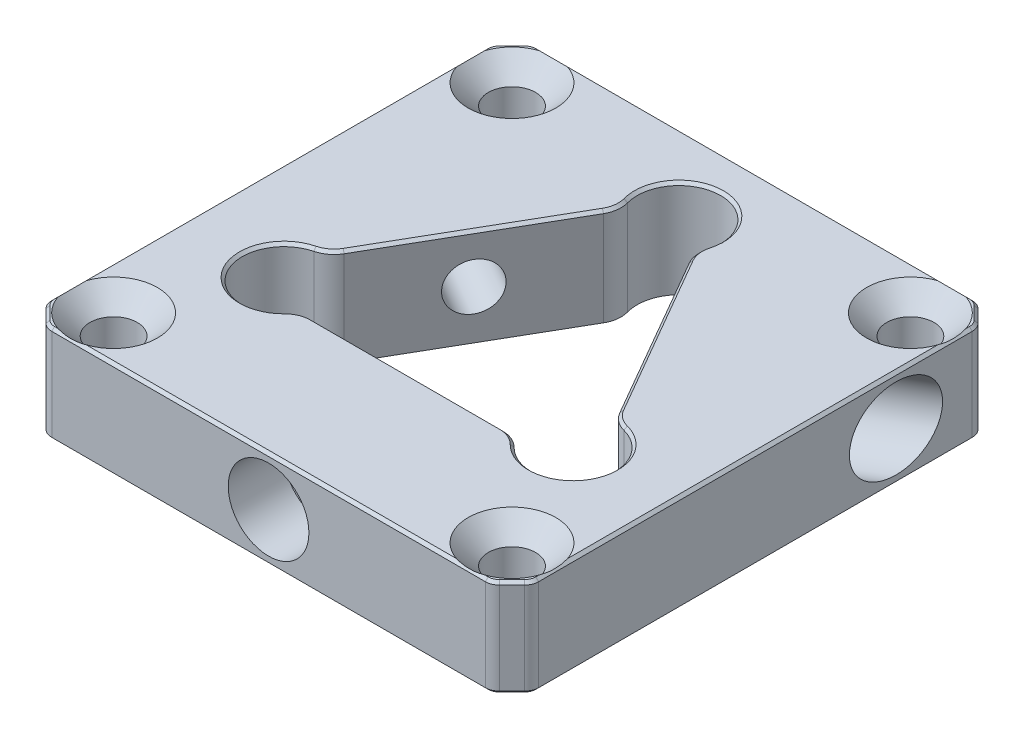
from build123d import *

# Parameters (mm, degrees)
SKETCH_36_W                  = 35
SKETCH_36_H                  = 35
EXTRUDE_8_DEPTH              = 7
SKETCH_37_R                  = 1
CUT_EXTRUDE_8_DEPTH          = 14
HOLE_WIZARD_M3_2_D           = 3.4
HOLE_WIZARD_M3_2_CSINK_D     = 6.3
HOLE_WIZARD_M3_2_CSINK_ANGLE = 90
CUT_EXTRUDE_9_DEPTH          = 9
FILLET_8_R                   = 3
SKETCH_41_R                  = 3
CUT_EXTRUDE_10_DEPTH         = 25.5
CHAMFER_3_SIZE               = 1.5
FILLET_9_R                   = 1
SKETCH_44_R                  = 1.7
CUT_EXTRUDE_11_DEPTH         = 16
PATTERN_CIRCULAR_4_COUNT     = 3
SKETCH_46_R                  = 2.9
CUT_EXTRUDE_12_DEPTH         = 9
SKETCH_47_R                  = 2.9
CUT_EXTRUDE_13_DEPTH         = 9
SKETCH_48_R                  = 2.9
CUT_EXTRUDE_14_DEPTH         = 4
FILLET_10_R                  = 2
SKETCH_49_R                  = 1
CUT_EXTRUDE_15_DEPTH         = 6
HOLE_WIZARD_M3_1_D           = 2.5
HOLE_WIZARD_M3_1_DEPTH       = 7
HOLE_WIZARD_M3_1_TIP         = 0.751075774
CHAMFER_4_SIZE               = 0.2
CHAMFER_5_SIZE               = 0.2


with BuildPart() as part:
    # 草图36 → 凸台-拉伸8 (new body)
    with BuildSketch(Plane(origin=(0, 0, 0), x_dir=(1, 0, 0), z_dir=(0, 1, 0))):
        Rectangle(SKETCH_36_W, SKETCH_36_H)
    extrude(amount=EXTRUDE_8_DEPTH)

    # 草图37 → 切除-拉伸8 (cut)
    with BuildSketch(Plane(origin=(0, 7, 0), x_dir=(1, 0, 0), z_dir=(0, 1, 0))):
        with Locations(Location((-14.32, 14.32, 0), (0, 0, 270))):
            Circle(SKETCH_37_R)
        with Locations(Location((14.32, 14.32, 0), (0, 0, 270))):
            Circle(SKETCH_37_R)
        with Locations(Location((14.32, -14.32, 0), (0, 0, 270))):
            Circle(SKETCH_37_R)
        with Locations(Location((-14.32, -14.32, 0), (0, 0, 270))):
            Circle(SKETCH_37_R)
    extrude(amount=-CUT_EXTRUDE_8_DEPTH, mode=Mode.SUBTRACT)

    # M3 十字槽半沉头木螺钉的锥形沉头孔2 (through all)
    with Locations(Plane(origin=(0, 7, 0), x_dir=(1, 0, 0), z_dir=(0, 1, 0))):
        with Locations((-14.32, 14.32), (-14.32, -14.32), (14.32, -14.32), (14.32, 14.32)):
            CounterSinkHole(HOLE_WIZARD_M3_2_D / 2, HOLE_WIZARD_M3_2_CSINK_D / 2, counter_sink_angle=HOLE_WIZARD_M3_2_CSINK_ANGLE)

    # 草图40 → 切除-拉伸9 (cut)
    with BuildSketch(Plane(origin=(0, 7, 0), x_dir=(1, 0, 0), z_dir=(0, 1, 0))):
        Polygon((0, 15), (-12.990381057, -7.5), (12.990381057, -7.5), align=None)
    extrude(amount=-CUT_EXTRUDE_9_DEPTH, mode=Mode.SUBTRACT)

    # 圆角8
    fillet_8_edges = [part.edges().sort_by_distance(p)[0] for p in [
        (0, 3.5, -15),
        (12.990381057, 3.5, 7.5),
        (-12.990381057, 3.5, 7.5),
    ]]
    fillet(fillet_8_edges, radius=FILLET_8_R)

    # 草图41 → 切除-拉伸10 (cut)
    with BuildSketch(Plane(origin=(0, 7, 0), x_dir=(1, 0, 0), z_dir=(0, 1, 0))):
        with Locations((0, 12)):
            Circle(SKETCH_41_R)
        with Locations((10.392304845, -6)):
            Circle(SKETCH_41_R)
        with Locations((-10.392304845, -6)):
            Circle(SKETCH_41_R)
    extrude(amount=-CUT_EXTRUDE_10_DEPTH, mode=Mode.SUBTRACT)

    # 倒角3
    chamfer_3_edges = [part.edges().sort_by_distance(p)[0] for p in [
        (17.5, 3.5, 17.5),
        (-17.5, 3.5, 17.5),
        (-17.5, 3.5, -17.5),
        (17.5, 3.5, -17.5),
    ]]
    chamfer(chamfer_3_edges, length=CHAMFER_3_SIZE)

    # 圆角9
    fillet_9_edges = [part.edges().sort_by_distance(p)[0] for p in [
        (16, 3.5, 17.5),
        (-16, 3.5, 17.5),
        (-17.5, 3.5, -16),
        (-17.5, 3.5, 16),
        (17.5, 3.5, -16),
        (17.5, 3.5, 16),
        (16, 3.5, -17.5),
        (-16, 3.5, -17.5),
    ]]
    fillet(fillet_9_edges, radius=FILLET_9_R)

    # 草图44 → 切除-拉伸11 (cut)
    with BuildSketch(Plane(origin=(-6.495190528, 0, -3.75), x_dir=(0.5000000000000003, 0, -0.8660254037844386), z_dir=(0.8660254037844386, 0, 0.5000000000000003))):
        with Locations((0, 3.5)):
            Circle(SKETCH_44_R)
    cut_extrude_11 = extrude(amount=-CUT_EXTRUDE_11_DEPTH, mode=Mode.SUBTRACT)

    # 阵列(圆周)4: 切除-拉伸11 ×3 about axis
    pattern_circular_4_axis = Axis((0, 61.25, 0), (0, -1, 0))
    for i in range(1, PATTERN_CIRCULAR_4_COUNT):
        add(cut_extrude_11.rotate(pattern_circular_4_axis, i * 360 / PATTERN_CIRCULAR_4_COUNT), mode=Mode.SUBTRACT)

    # 草图46 → 切除-拉伸12 (cut)
    with BuildSketch(Plane(origin=(-19.485571585, 0, -11.25), x_dir=(0.5000000000000003, 0, -0.8660254037844386), z_dir=(0.8660254037844386, 0, 0.5000000000000003))):
        with Locations(Location((0, 3.5, 0), (0, 0, 180))):
            Circle(SKETCH_46_R)
    extrude(amount=CUT_EXTRUDE_12_DEPTH, mode=Mode.SUBTRACT)

    # 草图47 → 切除-拉伸13 (cut)
    with BuildSketch(Plane(origin=(19.485571585, 0, -11.25), x_dir=(0.5000000000000003, 0, 0.8660254037844386), z_dir=(-0.8660254037844386, 0, 0.5000000000000003))):
        with Locations(Location((0, 3.5, 0), (0, 0, 180))):
            Circle(SKETCH_47_R)
    extrude(amount=CUT_EXTRUDE_13_DEPTH, mode=Mode.SUBTRACT)

    # 草图48 → 切除-拉伸14 (cut)
    with BuildSketch(Plane.XY.offset(17.5)):
        with Locations((0, 3.5)):
            Circle(SKETCH_48_R)
    extrude(amount=-CUT_EXTRUDE_14_DEPTH, mode=Mode.SUBTRACT)

    # 圆角10
    fillet_10_edges = [part.edges().sort_by_distance(p)[0] for p in [
        (2.598076211, 3.5, -10.5),
        (10.392304845, 3.5, 3),
        (-7.794228634, 3.5, 7.5),
        (7.794228634, 3.5, 7.5),
        (-2.598076211, 3.5, -10.5),
        (-10.392304845, 3.5, 3),
    ]]
    fillet(fillet_10_edges, radius=FILLET_10_R)

    # 草图49 → 切除-拉伸15 (cut)
    with BuildSketch(Plane(origin=(0, 0, -17.5), x_dir=(-1, 0, 0), z_dir=(0, 0, -1))):
        with Locations((-8, 3.5)):
            Circle(SKETCH_49_R)
        with Locations(Location((8, 3.5, 0), (0, 0, 180))):
            Circle(SKETCH_49_R)
    extrude(amount=-CUT_EXTRUDE_15_DEPTH, mode=Mode.SUBTRACT)

    # M3 螺纹孔1
    with Locations(Plane(origin=(0, 0, -17.5), x_dir=(-1, 0, 0), z_dir=(0, 0, -1))):
        with Locations((-8, 3.5), (8, 3.5)):
            Hole(HOLE_WIZARD_M3_1_D / 2, depth=HOLE_WIZARD_M3_1_DEPTH)
            with Locations((0, 0, -(HOLE_WIZARD_M3_1_DEPTH + HOLE_WIZARD_M3_1_TIP / 2))):  # 118° drill point
                Cone(0, HOLE_WIZARD_M3_1_D / 2, HOLE_WIZARD_M3_1_TIP, mode=Mode.SUBTRACT)

    # 倒角4
    # the kernel refuses this chamfer: 0.2 mm, written as the material it takes off along each edge
    with BuildSketch(Plane(origin=(-17.5, 0, 15.585786438), x_dir=(0.9996219169112968, -0.02749587661058673, 0), z_dir=(0, 0, -1)), Plane(origin=(-17.5, 7, 15.585786438), x_dir=(-0.027495876610578673, -0.999621916911297, 0), z_dir=(0, 0, -1)), Plane(origin=(15.585786438, 7, 17.5), x_dir=(0, -0.999621916911297, 0.027495876610578673), z_dir=(-1, 0, 0)), Plane(origin=(17.5, 7, -15.585786438), x_dir=(0.027495876610578673, -0.999621916911297, 0), z_dir=(0, 0, 1)), Plane(origin=(-15.585786438, 7, -17.5), x_dir=(0, -0.999621916911297, -0.027495876610578673), z_dir=(1, 0, 0)), Plane(origin=(15.585786438, 0, 17.5), x_dir=(0, -0.027495876610586726, -0.9996219169112966), z_dir=(-1, 0, 0)), Plane(origin=(-15.585786438, 0, -17.5), x_dir=(0, -0.027495876610586726, 0.9996219169112966), z_dir=(1, 0, 0)), Plane(origin=(17.5, 0, -15.585786438), x_dir=(-0.9996219169112968, -0.02749587661058673, 0), z_dir=(0, 0, 1))) as chamfer_4_piece_1:
        Polygon((CHAMFER_4_SIZE * 0.999621916911, -CHAMFER_4_SIZE * 0.0274958766106), (-CHAMFER_4_SIZE * 0.0274958766106, -CHAMFER_4_SIZE * 0.999621916911), (0, 0), align=None)
    extrude(amount=31.171572875, mode=Mode.SUBTRACT)
    with BuildSketch(Plane(origin=(-17.207106781, 7, 16.292893219), x_dir=(-0.019442520806012033, -0.9996219169112968, 0.019442520806012033), z_dir=(0.7071067811865476, 0, 0.7071067811865476)), Plane(origin=(16.292893219, 7, 17.207106781), x_dir=(0.019442520806020658, -0.9996219169112964, 0.019442520806020658), z_dir=(0.7071067811865476, 0, -0.7071067811865476)), Plane(origin=(17.207106781, 7, -16.292893219), x_dir=(0.019442520806020658, -0.9996219169112964, -0.019442520806020658), z_dir=(-0.7071067811865476, 0, -0.7071067811865476)), Plane(origin=(-17.207106781, 0, 16.292893219), x_dir=(0.7068394360706735, -0.027495876610586372, -0.7068394360706735), z_dir=(0.7071067811865476, 0, 0.7071067811865476)), Plane(origin=(17.207106781, 0, -16.292893219), x_dir=(-0.7068394360706735, -0.0274958766105862, 0.7068394360706735), z_dir=(-0.7071067811865476, 0, -0.7071067811865476)), Plane(origin=(16.292893219, 0, 17.207106781), x_dir=(-0.7068394360706735, -0.0274958766105862, -0.7068394360706735), z_dir=(0.7071067811865476, 0, -0.7071067811865476))) as chamfer_4_piece_2:
        Polygon((CHAMFER_4_SIZE * 0.999621916911, CHAMFER_4_SIZE * 0.0274958766106), (-CHAMFER_4_SIZE * 0.0274958766106, CHAMFER_4_SIZE * 0.999621916911), (0, 0), align=None)
    extrude(amount=1.292893219, mode=Mode.SUBTRACT)
    with BuildSketch(Plane(origin=(-17.207106781, 7, -16.292893219), x_dir=(-0.019442520806012033, -0.9996219169112968, -0.019442520806012033), z_dir=(0.7071067811865476, 0, -0.7071067811865476)), Plane(origin=(-17.207106781, 0, -16.292893219), x_dir=(0.7068394360706735, -0.027495876610586372, 0.7068394360706735), z_dir=(0.7071067811865476, 0, -0.7071067811865476))) as chamfer_4_piece_3:
        Polygon((CHAMFER_4_SIZE * 0.999621916911, -CHAMFER_4_SIZE * 0.0274958766106), (-CHAMFER_4_SIZE * 0.0274958766106, -CHAMFER_4_SIZE * 0.999621916911), (0, 0), align=None)
    extrude(amount=1.292893219, mode=Mode.SUBTRACT)
    with BuildSketch(Plane(origin=(-15.585786438, 7, -16.5), x_dir=(0, 0, -1), z_dir=(1, 0, 0))) as chamfer_4_piece_4:
        Polygon((1, -CHAMFER_4_SIZE), (1 - CHAMFER_4_SIZE, 0), (1, 0), align=None)
    revolve(axis=Axis((-15.585786438, 7, -16.5), (0, 1, 0)), revolution_arc=45, mode=Mode.SUBTRACT)
    with BuildSketch(Plane(origin=(-16.5, 7, -15.585786438), x_dir=(-0.7071067811865476, 0, -0.7071067811865476), z_dir=(0.7071067811865476, 0, -0.7071067811865476))) as chamfer_4_piece_5:
        Polygon((1, -CHAMFER_4_SIZE), (1 - CHAMFER_4_SIZE, 0), (1, 0), align=None)
    revolve(axis=Axis((-16.5, 7, -15.585786438), (0, 1, 0)), revolution_arc=45, mode=Mode.SUBTRACT)
    with BuildSketch(Plane(origin=(15.585786438, 7, -16.5), x_dir=(0, 0, -1), z_dir=(-1, 0, 0))) as chamfer_4_piece_6:
        Polygon((1, CHAMFER_4_SIZE), (1 - CHAMFER_4_SIZE, 0), (1, 0), align=None)
    revolve(axis=Axis((15.585786438, 7, -16.5), (0, -1, 0)), revolution_arc=45, mode=Mode.SUBTRACT)
    with BuildSketch(Plane(origin=(16.5, 7, -15.585786438), x_dir=(0.7071067811865458, 0, -0.7071067811865493), z_dir=(-0.7071067811865493, 0, -0.7071067811865458))) as chamfer_4_piece_7:
        Polygon((1, CHAMFER_4_SIZE), (1 - CHAMFER_4_SIZE, 0), (1, 0), align=None)
    revolve(axis=Axis((16.5, 7, -15.585786438), (0, -1, 0)), revolution_arc=45, mode=Mode.SUBTRACT)
    with BuildSketch(Plane(origin=(16.5, 7, 15.585786438), x_dir=(1, 0, 0), z_dir=(0, 0, -1))) as chamfer_4_piece_8:
        Polygon((1, CHAMFER_4_SIZE), (1 - CHAMFER_4_SIZE, 0), (1, 0), align=None)
    revolve(axis=Axis((16.5, 7, 15.585786438), (0, -1, 0)), revolution_arc=45, mode=Mode.SUBTRACT)
    with BuildSketch(Plane(origin=(15.585786438, 7, 16.5), x_dir=(0.7071067811865476, 0, 0.7071067811865476), z_dir=(0.7071067811865476, 0, -0.7071067811865476))) as chamfer_4_piece_9:
        Polygon((1, CHAMFER_4_SIZE), (1 - CHAMFER_4_SIZE, 0), (1, 0), align=None)
    revolve(axis=Axis((15.585786438, 7, 16.5), (0, -1, 0)), revolution_arc=45, mode=Mode.SUBTRACT)
    with BuildSketch(Plane(origin=(-15.585786438, 7, 16.5), x_dir=(-0.7071067811865476, 0, 0.7071067811865476), z_dir=(-0.7071067811865476, 0, -0.7071067811865476))) as chamfer_4_piece_10:
        Polygon((1, -CHAMFER_4_SIZE), (1 - CHAMFER_4_SIZE, 0), (1, 0), align=None)
    revolve(axis=Axis((-15.585786438, 7, 16.5), (0, 1, 0)), revolution_arc=45, mode=Mode.SUBTRACT)
    with BuildSketch(Plane(origin=(-16.5, 7, 15.585786438), x_dir=(-1, 0, 0), z_dir=(0, 0, -1))) as chamfer_4_piece_11:
        Polygon((1, -CHAMFER_4_SIZE), (1 - CHAMFER_4_SIZE, 0), (1, 0), align=None)
    revolve(axis=Axis((-16.5, 7, 15.585786438), (0, 1, 0)), revolution_arc=45, mode=Mode.SUBTRACT)
    with BuildSketch(Plane(origin=(-15.585786438, 0, -16.5), x_dir=(0, 0, -1), z_dir=(1, 0, 0))) as chamfer_4_piece_12:
        Polygon((1 - CHAMFER_4_SIZE, 0), (1, CHAMFER_4_SIZE), (1, 0), align=None)
    revolve(axis=Axis((-15.585786438, 0, -16.5), (0, 1, 0)), revolution_arc=45, mode=Mode.SUBTRACT)
    with BuildSketch(Plane(origin=(-16.5, 0, -15.585786438), x_dir=(-0.7071067811865476, 0, -0.7071067811865476), z_dir=(0.7071067811865476, 0, -0.7071067811865476))) as chamfer_4_piece_13:
        Polygon((1 - CHAMFER_4_SIZE, 0), (1, CHAMFER_4_SIZE), (1, 0), align=None)
    revolve(axis=Axis((-16.5, 0, -15.585786438), (0, 1, 0)), revolution_arc=45, mode=Mode.SUBTRACT)
    with BuildSketch(Plane(origin=(15.585786438, 0, -16.5), x_dir=(0, 0, -1), z_dir=(-1, 0, 0))) as chamfer_4_piece_14:
        Polygon((1 - CHAMFER_4_SIZE, 0), (1, -CHAMFER_4_SIZE), (1, 0), align=None)
    revolve(axis=Axis((15.585786438, 0, -16.5), (0, -1, 0)), revolution_arc=45, mode=Mode.SUBTRACT)
    with BuildSketch(Plane(origin=(16.5, 0, -15.585786438), x_dir=(0.7071067811865476, 0, -0.7071067811865476), z_dir=(-0.7071067811865476, 0, -0.7071067811865476))) as chamfer_4_piece_15:
        Polygon((1 - CHAMFER_4_SIZE, 0), (1, -CHAMFER_4_SIZE), (1, 0), align=None)
    revolve(axis=Axis((16.5, 0, -15.585786438), (0, -1, 0)), revolution_arc=45, mode=Mode.SUBTRACT)
    with BuildSketch(Plane(origin=(16.5, 0, 15.585786438), x_dir=(1, 0, 0), z_dir=(0, 0, -1))) as chamfer_4_piece_16:
        Polygon((1 - CHAMFER_4_SIZE, 0), (1, -CHAMFER_4_SIZE), (1, 0), align=None)
    revolve(axis=Axis((16.5, 0, 15.585786438), (0, -1, 0)), revolution_arc=45, mode=Mode.SUBTRACT)
    with BuildSketch(Plane(origin=(15.585786438, 0, 16.5), x_dir=(0.7071067811865493, 0, 0.7071067811865458), z_dir=(0.7071067811865458, 0, -0.7071067811865493))) as chamfer_4_piece_17:
        Polygon((1 - CHAMFER_4_SIZE, 0), (1, -CHAMFER_4_SIZE), (1, 0), align=None)
    revolve(axis=Axis((15.585786438, 0, 16.5), (0, -1, 0)), revolution_arc=45, mode=Mode.SUBTRACT)
    with BuildSketch(Plane(origin=(-15.585786438, 0, 16.5), x_dir=(-0.7071067811865476, 0, 0.7071067811865476), z_dir=(-0.7071067811865476, 0, -0.7071067811865476))) as chamfer_4_piece_18:
        Polygon((1 - CHAMFER_4_SIZE, 0), (1, CHAMFER_4_SIZE), (1, 0), align=None)
    revolve(axis=Axis((-15.585786438, 0, 16.5), (0, 1, 0)), revolution_arc=45, mode=Mode.SUBTRACT)
    with BuildSketch(Plane(origin=(-16.5, 0, 15.585786438), x_dir=(-1, 0, 0), z_dir=(0, 0, -1))) as chamfer_4_piece_19:
        Polygon((1 - CHAMFER_4_SIZE, 0), (1, CHAMFER_4_SIZE), (1, 0), align=None)
    revolve(axis=Axis((-16.5, 0, 15.585786438), (0, 1, 0)), revolution_arc=45, mode=Mode.SUBTRACT)

    # 倒角5
    chamfer_5_edges = [part.edges().sort_by_distance(p)[0] for p in [
        (0, 7, 7.5),
        (12.990381057, 7, 7.5),
        (0, 7, -15),
        (6.495190528, 7, -3.75),
        (-12.990381057, 7, 7.5),
        (-6.495190528, 7, -3.75),
        (2.832275743, 7, -10.406536728),
        (10.428463044, 7, 2.75044562),
        (-10.428463044, 7, 2.75044562),
        (-2.832275743, 7, -10.406536728),
        (-7.5961873, 7, 7.656091109),
        (7.5961873, 7, 7.656091109),
    ]]
    chamfer(chamfer_5_edges, length=CHAMFER_5_SIZE)


solid = part.part
